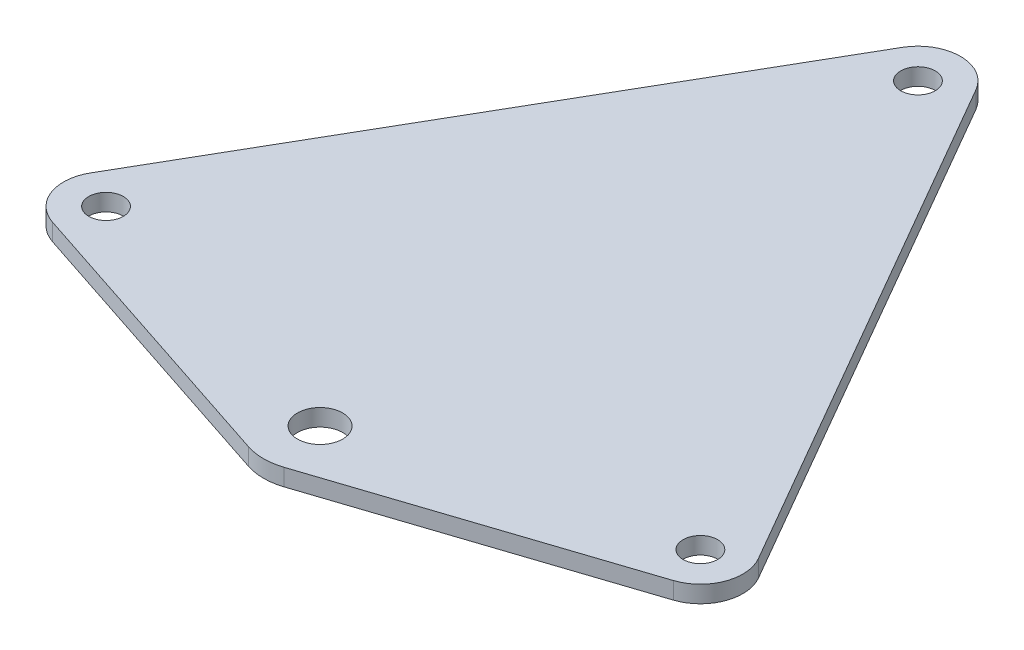
from build123d import *

# Parameters (mm, degrees)
SKETCH1_R           = 3.05
SKETCH1_R_2         = 4
BOSS_EXTRUDE1_DEPTH = 3


with BuildPart() as part:
    # Sketch1 → Boss-Extrude1 (new body)
    with BuildSketch(Plane(origin=(0, 0, 0), x_dir=(1, 0, 0), z_dir=(0, 1, 0))):
        with BuildLine():
            ThreePointArc((6.495190528, 64.371778265), (0, 68.121778265), (-6.495190528, 64.371778265))
            Line((-6.495190528, 64.371778265), (-58.995190528, -26.560889132))
            ThreePointArc((-58.995190528, -26.560889132), (-59.507924452, -32.98277889), (-54.849923408, -37.433238462))
            Line((-54.849923408, -37.433238462), (-3.133231211, -54.496465773))
            ThreePointArc((-3.133231211, -54.496465773), (0, -55), (3.133231211, -54.496465773))
            Line((3.133231211, -54.496465773), (54.849923408, -37.433238462))
            ThreePointArc((54.849923408, -37.433238462), (59.507924452, -32.98277889), (58.995190528, -26.560889132))
            Line((58.995190528, -26.560889132), (6.495190528, 64.371778265))
        make_face()
        with Locations((-52.5, -30.310889132)):
            Circle(SKETCH1_R, mode=Mode.SUBTRACT)
        with Locations((52.5, -30.310889132)):
            Circle(SKETCH1_R, mode=Mode.SUBTRACT)
        with Locations((0, 60.621778265)):
            Circle(SKETCH1_R, mode=Mode.SUBTRACT)
        with Locations((0, -45)):
            Circle(SKETCH1_R_2, mode=Mode.SUBTRACT)
    extrude(amount=BOSS_EXTRUDE1_DEPTH)


solid = part.part
